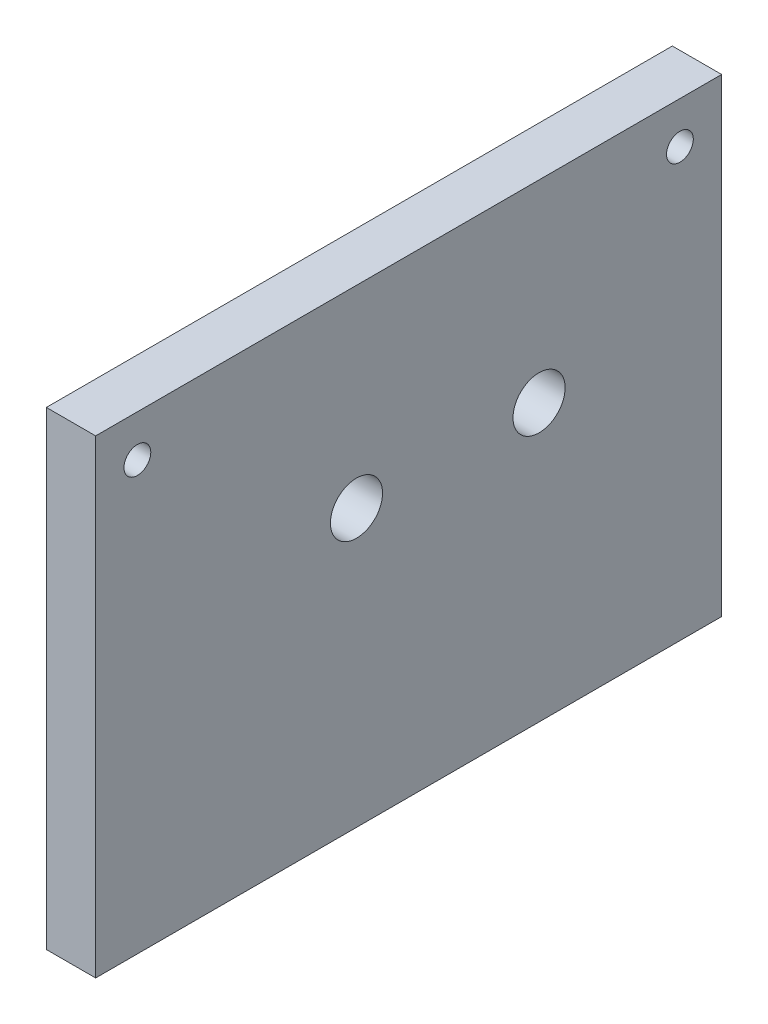
from build123d import *

# Parameters (mm, degrees)
SKETCH1_W                      = 152.4
SKETCH1_H                      = 114.3
SKETCH1_R                      = 6.34365
BOSS_EXTRUDE1_DEPTH            = 12
TAP_DRILL_FOR_10_32_TAP1_D     = 4.0386
TAP_DRILL_FOR_10_32_TAP1_DEPTH = 12.7
TAP_DRILL_FOR_10_32_TAP1_TIP   = 1.213317848
F_1_4_CLEARANCE_HOLE1_D        = 6.5278
F_1_4_CLEARANCE_HOLE1_DEPTH    = 12.7
F_1_4_CLEARANCE_HOLE1_TIP      = 1.961148974


with BuildPart() as part:
    # Sketch1 → Boss-Extrude1 (new body)
    with BuildSketch(Plane(origin=(0, 0, 0), x_dir=(0, 0, -1), z_dir=(1, 0, 0))):
        Rectangle(SKETCH1_W, SKETCH1_H)
        with Locations((-12.7, 10.16)):
            Circle(SKETCH1_R, mode=Mode.SUBTRACT)
        with Locations((31.75, 10.16)):
            Circle(SKETCH1_R, mode=Mode.SUBTRACT)
    extrude(amount=BOSS_EXTRUDE1_DEPTH)

    # Tap Drill for #10-32 Tap1
    with Locations(Plane(origin=(0, -57.15, 0), x_dir=(-1, 0, 0), z_dir=(0, -1, 0))):
        with Locations((-6, -66.675), (-6, 0), (-6, 66.675)):
            Hole(TAP_DRILL_FOR_10_32_TAP1_D / 2, depth=TAP_DRILL_FOR_10_32_TAP1_DEPTH)
            with Locations((0, 0, -(TAP_DRILL_FOR_10_32_TAP1_DEPTH + TAP_DRILL_FOR_10_32_TAP1_TIP / 2))):  # 118° drill point
                Cone(0, TAP_DRILL_FOR_10_32_TAP1_D / 2, TAP_DRILL_FOR_10_32_TAP1_TIP, mode=Mode.SUBTRACT)

    # 1/4 Clearance Hole1
    with Locations(Plane.ZY):
        with Locations((-66.04, 46.99), (66.04, 46.99)):
            Hole(F_1_4_CLEARANCE_HOLE1_D / 2, depth=F_1_4_CLEARANCE_HOLE1_DEPTH)
            with Locations((0, 0, -(F_1_4_CLEARANCE_HOLE1_DEPTH + F_1_4_CLEARANCE_HOLE1_TIP / 2))):  # 118° drill point
                Cone(0, F_1_4_CLEARANCE_HOLE1_D / 2, F_1_4_CLEARANCE_HOLE1_TIP, mode=Mode.SUBTRACT)


solid = part.part
